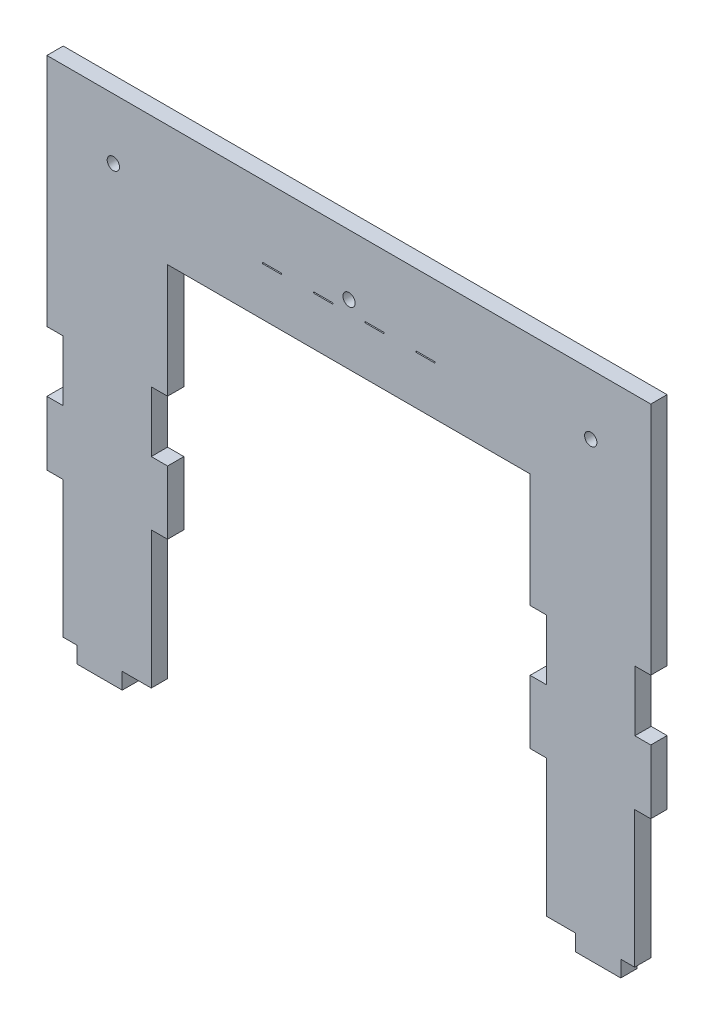
from build123d import *

# Parameters (mm, degrees)
SKETCH1_R  = 1.016
SKETCH1_W  = 3.175
SKETCH1_H  = 0.2
BASE_DEPTH = 2.7


with BuildPart() as part:
    # Sketch1 → Base (new body)
    with BuildSketch(Plane.XY):
        Polygon((-34.517386137, -9.480737498), (-34.517386137, 13.201100992), (-31.817386137, 13.201100992), (-31.817386137, 23.701100992), (-34.517386137, 23.701100992), (-34.517386137, 33.701100992), (-31.817386137, 33.701100992), (-31.817386137, 52.561262502), (28.182613863, 52.561262502), (28.182613863, 33.701100992), (30.882613863, 33.701100992), (30.882613863, 23.701100992), (28.182613863, 23.701100992), (28.182613863, 13.201100992), (30.882613863, 13.201100992), (30.882613863, -9.480737498), (35.682613863, -9.480737498), (35.682613863, -12.180737498), (43.182613863, -12.180737498), (43.182613863, -9.480737498), (45.482613863, -9.480737498), (45.482613863, 13.121905033), (48.150227726, 13.121905033), (48.150227726, 23.701100992), (45.515, 23.701100992), (45.515, 33.701100992), (48.150227726, 33.701100992), (48.150227726, 72.561262502), (-51.785, 72.561262502), (-51.785, 33.701100992), (-49.149772274, 33.701100992), (-49.149772274, 23.701100992), (-51.785, 23.701100992), (-51.785, 13.121905033), (-49.117386137, 13.121905033), (-49.117386137, -9.480737498), (-46.817386137, -9.480737498), (-46.817386137, -12.180737498), (-39.317386137, -12.180737498), (-39.317386137, -9.480737498), align=None)
        with Locations((-40.7925, 62.561262502)):
            Circle(SKETCH1_R, mode=Mode.SUBTRACT)
        with Locations((38.215, 62.561262502)):
            Circle(SKETCH1_R, mode=Mode.SUBTRACT)
        with Locations((-1.785, 62.561262502)):
            Circle(SKETCH1_R, mode=Mode.SUBTRACT)
        with Locations((-14.522386137, 60.661262502)):
            Rectangle(SKETCH1_W, SKETCH1_H, mode=Mode.SUBTRACT)
        with Locations((-6.052386137, 60.661262502)):
            Rectangle(SKETCH1_W, SKETCH1_H, mode=Mode.SUBTRACT)
        with Locations((2.417613863, 60.661262502)):
            Rectangle(SKETCH1_W, SKETCH1_H, mode=Mode.SUBTRACT)
        with Locations((10.887613863, 60.661262502)):
            Rectangle(SKETCH1_W, SKETCH1_H, mode=Mode.SUBTRACT)
    extrude(amount=BASE_DEPTH)


solid = part.part
